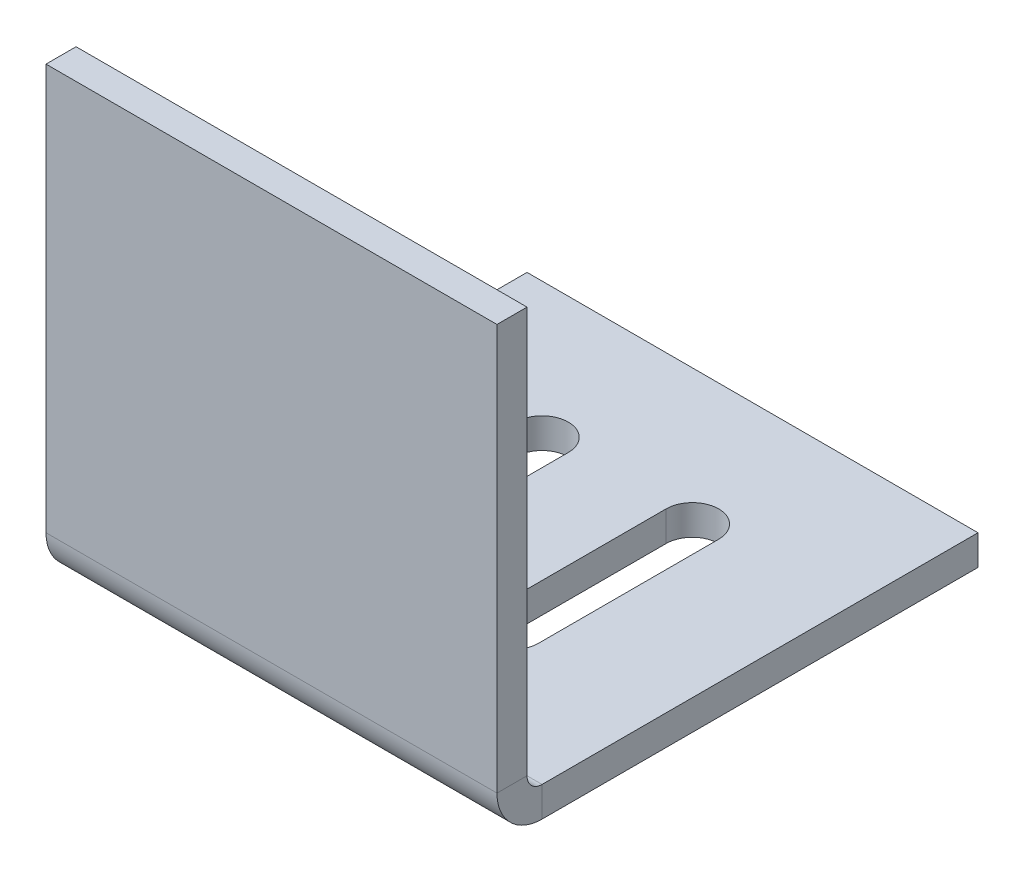
from build123d import *

# Parameters (mm, degrees)
SKETCH1_W                    = 30
SKETCH1_H                    = 30
BASE_FLANGE1_DEPTH           = 2
EDGE_FLANGE1_STRIP_W         = 10
EDGE_FLANGE1_STRIP_H         = 2
EDGE_FLANGE1_STRIP_CUT_DEPTH = 30
EDGE_FLANGE1_DEPTH           = 30


# Sheet-metal steps are written as plain solids
with BuildPart() as part:
    # Sketch1 → Base-Flange1 (new body)
    with BuildSketch(Plane(origin=(0, 0, 0), x_dir=(1, 0, 0), z_dir=(0, 1, 0))):
        Rectangle(SKETCH1_W, SKETCH1_H)
        with BuildLine():
            Line((-6.75, -6), (-6.75, 6))
            ThreePointArc((-6.75, 6), (-5, 7.75), (-3.25, 6))
            Line((-3.25, 6), (-3.25, -6))
            ThreePointArc((-3.25, -6), (-5, -7.75), (-6.75, -6))
        make_face(mode=Mode.SUBTRACT)
        with BuildLine():
            Line((3.25, -6), (3.25, 6))
            ThreePointArc((3.25, 6), (5, 7.75), (6.75, 6))
            Line((6.75, 6), (6.75, -6))
            ThreePointArc((6.75, -6), (5, -7.75), (3.25, -6))
        make_face(mode=Mode.SUBTRACT)
    extrude(amount=-BASE_FLANGE1_DEPTH)

    # Edge-Flange1 strip (across the edge) → Edge-Flange1 strip cut (cut)
    with BuildSketch(Plane(origin=(-15, 0, 15), x_dir=(0, 0, -1), z_dir=(1, 0, 0))):
        with Locations((-4, -1)):
            Rectangle(EDGE_FLANGE1_STRIP_W, EDGE_FLANGE1_STRIP_H)
    extrude(amount=EDGE_FLANGE1_STRIP_CUT_DEPTH, mode=Mode.SUBTRACT)

    # Edge-Flange1 section (across the edge) → Edge-Flange1 (add)
    with BuildSketch(Plane(origin=(-15, 0, 15), x_dir=(0, 0, -1), z_dir=(1, 0, 0))):
        with BuildLine():
            Line((-2, 1), (-2, 28))
            Line((-2, 28), (0, 28))
            Line((0, 28), (0, 1))
            ThreePointArc((0, 1), (0.292893219, 0.292893219), (1, 0))
            Line((1, 0), (1, -2))
            ThreePointArc((1, -2), (-1.121320344, -1.121320344), (-2, 1))
        make_face()
    extrude(amount=EDGE_FLANGE1_DEPTH)


solid = part.part
